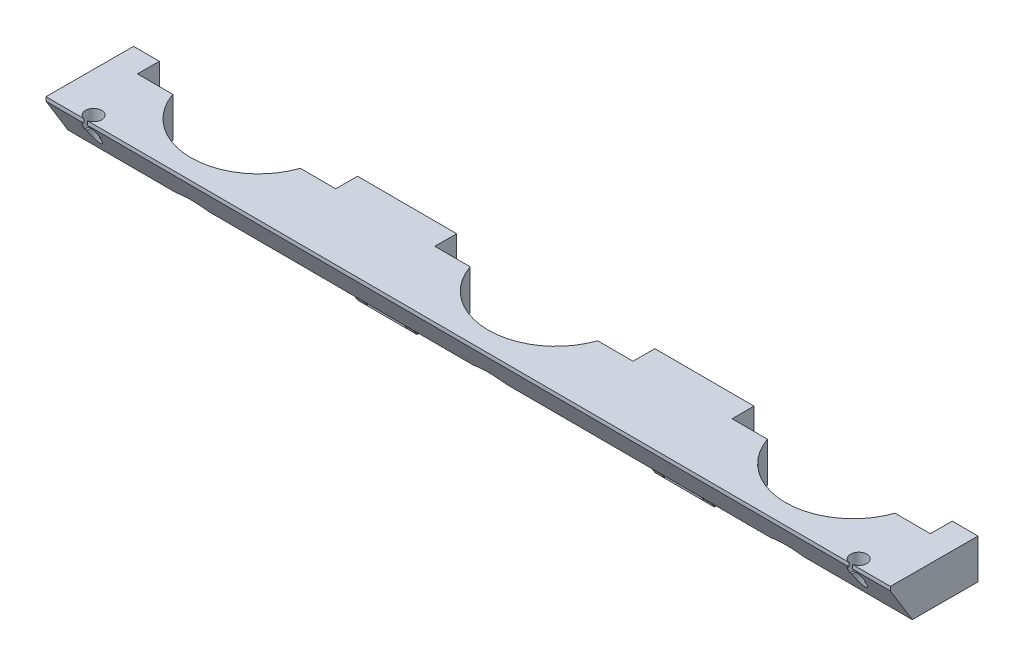
from build123d import *

# Parameters (mm, degrees)
BOSS_EXTRUDE3_DEPTH        = 10
SKETCH4_R                  = 1.5
BOSS_EXTRUDE4_DEPTH        = 5
RIB6_REACH                 = 158.985
SKETCH5_WALL_W             = 329.861950248
SKETCH5_WALL_H             = 2.5
CHAMFER2_SIZE              = 1
CHAMFER3_SIZE              = 5.5
CHAMFER3_SIZE_2            = 9
LPATTERN4_COUNT            = 2
LPATTERN4_PITCH            = 75
LPATTERN4_COPY_1_REACH     = 158.985
LPATTERN4_COPY_1_SKETCH_W  = 329.861950248
LPATTERN4_COPY_1_SKETCH_H  = 2.5
CHAMFER2_OF_LPATTERN4_SIZE = 1
SKETCH8_R                  = 2.05
CUT_EXTRUDE1_DEPTH         = 4
SKETCH9_R                  = 1.6
CUT_EXTRUDE2_DEPTH         = 5


with BuildPart() as part:
    # Sketch2 → Boss-Extrude3 (new body)
    with BuildSketch(Plane(origin=(0, 0, 0), x_dir=(1, 0, 0), z_dir=(0, 1, 0))):
        with BuildLine():
            Line((-138.973021921, 39.179223473), (-139.022764358, 17.179279707))
            Line((-139.022764358, 17.179279707), (73.976691191, 16.697682479))
            Line((73.976691191, 16.697682479), (74.026978079, 38.697625014))
            Line((74.026978079, 38.697625014), (67.526578048, 38.712322585))
            Line((67.526578048, 38.712322585), (67.51414235, 33.212297518))
            Line((67.51414235, 33.212297518), (58.599731895, 33.232453229))
            ThreePointArc((58.599731895, 33.232453229), (42.488076808, 21.768891824), (26.428425, 33.305193378))
            Line((26.428425, 33.305193378), (17.51414235, 33.3253488))
            Line((17.51414235, 33.3253488), (17.526578048, 38.825373866))
            Line((17.526578048, 38.825373866), (-7.473230244, 38.881899074))
            Line((-7.473230244, 38.881899074), (-7.485665941, 33.381874007))
            Line((-7.485665941, 33.381874007), (-16.400076396, 33.402029717))
            ThreePointArc((-16.400076396, 33.402029717), (-32.511731484, 21.938468313), (-48.571383292, 33.474769867))
            Line((-48.571383292, 33.474769867), (-57.485665941, 33.494925288))
            Line((-57.485665941, 33.494925288), (-57.473230244, 38.994950355))
            Line((-57.473230244, 38.994950355), (-82.473038536, 39.051475562))
            Line((-82.473038536, 39.051475562), (-82.485474233, 33.551450496))
            Line((-82.485474233, 33.551450496), (-91.399884688, 33.571606206))
            ThreePointArc((-91.399884688, 33.571606206), (-107.511539776, 22.108044802), (-123.571191584, 33.644346356))
            Line((-123.571191584, 33.644346356), (-132.485474233, 33.664501777))
            Line((-132.485474233, 33.664501777), (-132.473038536, 39.164526844))
            Line((-132.473038536, 39.164526844), (-138.973021921, 39.179223473))
        make_face()
    extrude(amount=BOSS_EXTRUDE3_DEPTH)

    # Sketch4 → Boss-Extrude4 (add)
    with BuildSketch(Plane(origin=(0.087874316, 0, -38.864803222), x_dir=(-0.99999744389135, 0, -0.002261019850970016), z_dir=(0.002261019850970016, 0, -0.99999744389135))):
        Polygon((62.56118779, -12), (57.561251693, 0), (82.561123887, 0), (77.56118779, -12), align=None)
        with Locations((70.06118779, -8.5)):
            Circle(SKETCH4_R, mode=Mode.SUBTRACT)
    boss_extrude4 = extrude(amount=-BOSS_EXTRUDE4_DEPTH)

    # Sketch5 wall → Rib6 (add, up to next)
    with BuildSketch(Plane(origin=(-77.492333887, -6, -30.540192335), x_dir=(-0.001139262394, 0.863778900906, 0.503869737562), z_dir=(-0.001953021242, -0.503871025511, 0.863776692993)), mode=Mode.PRIVATE) as rib6_sk1:
        with Locations((0, -1.25)):
            Rectangle(SKETCH5_WALL_W, SKETCH5_WALL_H)
    rib6_tool1 = extrude(rib6_sk1.sketch, amount=-RIB6_REACH, mode=Mode.PRIVATE) - part.part
    rib6 = rib6_tool1.solids().sort_by_distance((-77.492333887, -6, -30.540192335))[0]
    add(rib6)

    # Mirror2: Rib6 across plane
    add(rib6.mirror(Plane(origin=(-70.061008706, 0, -0.158409736), x_dir=(-0.0022610198509701073, 0, 0.99999744389135), z_dir=(0.99999744389135, 0, 0.002261019850970107))))

    # Chamfer2
    chamfer2_edges = [part.edges().sort_by_distance(p)[0] for p in [
        (-68.484443323, -8.5, -34.01983421),
    ]]
    chamfer(chamfer2_edges, length=CHAMFER2_SIZE)

    # Chamfer3
    # the kernel refuses this chamfer: 9, 5.5 mm, written as the material it takes off along each edge
    with BuildSketch(Plane(origin=(-162.295390883, 0, -17.231899712), x_dir=(0.0022577295255832275, -0.053929224624231706, -0.9985422081158205), z_dir=(0.9999974438913499, 0, 0.0022610198509699707))) as chamfer3_piece_1:
        Polygon((CHAMFER3_SIZE * 0.998544760505, CHAMFER3_SIZE * 0.0539292246242), (-CHAMFER3_SIZE_2 * 0.0539292246242, CHAMFER3_SIZE_2 * 0.998544760505), (0, 0), align=None)
    extrude(amount=259.545372026, mode=Mode.SUBTRACT)

    # LPattern4: Boss-Extrude4, Rib6 ×2
    with Locations(*[Vector(0.9999974438913499, 0, 0.002261019850970079) * (i * LPATTERN4_PITCH) for i in range(1, LPATTERN4_COUNT)]):
        add(boss_extrude4)
        add(rib6)

    # LPattern4 copy 1 sketch → LPattern4 copy 1 (add, up to next)
    with BuildSketch(Plane(origin=(12.507436062, -6, -30.336700548), x_dir=(-0.0011392623880184954, 0.863778900906, 0.5038697375620136), z_dir=(-0.0019530212415939509, -0.503871025511, 0.863776692993001)), mode=Mode.PRIVATE) as lpattern4_copy_1_sk1:
        with Locations((0, 1.25)):
            Rectangle(LPATTERN4_COPY_1_SKETCH_W, LPATTERN4_COPY_1_SKETCH_H)
    lpattern4_copy_1_tool1 = extrude(lpattern4_copy_1_sk1.sketch, amount=-LPATTERN4_COPY_1_REACH, mode=Mode.PRIVATE) - part.part
    add(lpattern4_copy_1_tool1.solids().sort_by_distance((12.507436062, -6, -30.336700548))[0])

    # Chamfer2 of LPattern4
    chamfer2_of_lpattern4_edges = [part.edges().sort_by_distance(p)[0] for p in [
        (6.515364969, -8.5, -33.850257721),
    ]]
    chamfer(chamfer2_of_lpattern4_edges, length=CHAMFER2_OF_LPATTERN4_SIZE)

    # Sketch8 → Cut-Extrude1 (cut)
    with BuildSketch(Plane(origin=(0, 10, 0), x_dir=(1, 0, 0), z_dir=(0, 1, 0))):
        with Locations((-129.018242433, 19.156613217)):
            Circle(SKETCH8_R)
    cut_extrude1 = extrude(amount=-CUT_EXTRUDE1_DEPTH, mode=Mode.SUBTRACT)

    # Sketch9 → Cut-Extrude2 (cut)
    with BuildSketch(Plane(origin=(0, 6, 0), x_dir=(1, 0, 0), z_dir=(0, 1, 0))):
        with Locations((-129.018242433, 19.156613217)):
            Circle(SKETCH9_R)
    cut_extrude2 = extrude(amount=-CUT_EXTRUDE2_DEPTH, mode=Mode.SUBTRACT)

    # Mirror4: Cut-Extrude1, Cut-Extrude2 across plane
    add(cut_extrude1.mirror(Plane(origin=(-32.561168463, 0, -0.073621636), x_dir=(-0.002261019850969509, 0, 0.99999744389135), z_dir=(-0.99999744389135, 0, -0.0022610198509695084))), mode=Mode.SUBTRACT)
    add(cut_extrude2.mirror(Plane(origin=(-32.561168463, 0, -0.073621636), x_dir=(-0.002261019850969509, 0, 0.99999744389135), z_dir=(-0.99999744389135, 0, -0.0022610198509695084))), mode=Mode.SUBTRACT)


solid = part.part
